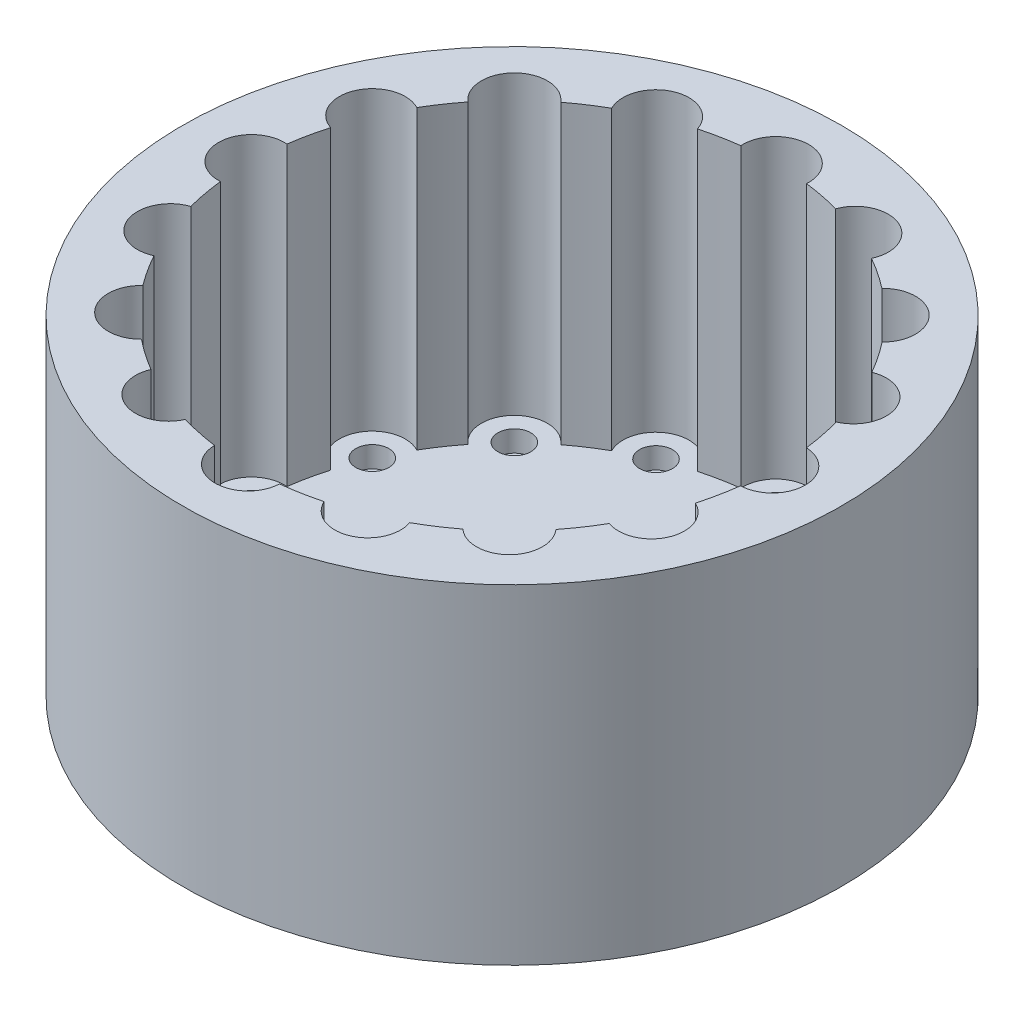
from build123d import *

# Parameters (mm, degrees)
SKETCH1_R           = 50
BOSS_EXTRUDE1_DEPTH = 45
BOSS_EXTRUDE2_START = 5
SKETCH2_R           = 50
BOSS_EXTRUDE2_DEPTH = 5
SKETCH4_R           = 17.5
CUT_EXTRUDE2_DEPTH  = 10
SKETCH5_R           = 2.5
CUT_EXTRUDE3_DEPTH  = 3.2


with BuildPart() as part:
    # Sketch1 → Boss-Extrude1 (new body)
    with BuildSketch(Plane(origin=(0, 0, 0), x_dir=(1, 0, 0), z_dir=(0, 1, 0))):
        Circle(SKETCH1_R)
        with BuildLine():
            ThreePointArc((-38.472091197, 10.949803601), (-39.142843019, 8.236373014), (-39.622464899, 5.482725176))
            ThreePointArc((-39.622464899, 5.482725176), (-45.027736203, 0.561560709), (-39.746875, -4.492875219))
            ThreePointArc((-39.746875, -4.492875219), (-39.333953887, -7.269117664), (-38.72736158, -10.009568673))
            ThreePointArc((-38.72736158, -10.009568673), (-41.748946282, -16.583911093), (-35.039748856, -19.292900251))
            ThreePointArc((-35.039748856, -19.292900251), (-33.590491244, -21.718169766), (-31.973653194, -24.035088963))
            ThreePointArc((-31.973653194, -24.035088963), (-32.157729031, -31.176050772), (-25.014492656, -31.213381059))
            ThreePointArc((-25.014492656, -31.213381059), (-22.728868069, -32.915020223), (-20.32789937, -34.449622744))
            ThreePointArc((-20.32789937, -34.449622744), (-17.707258167, -40.991172437), (-11.148020432, -38.415122549))
            ThreePointArc((-11.148020432, -38.415122549), (-8.358901204, -39.11686044), (-5.526568431, -39.6163734))
            ThreePointArc((-5.526568431, -39.6163734), (-0.59402965, -44.528471783), (4.46778962, -39.749702589))
            ThreePointArc((4.46778962, -39.749702589), (7.33562934, -39.321604013), (10.164921368, -38.686875986))
            ThreePointArc((10.164921368, -38.686875986), (16.574401115, -41.242300251), (19.433073291, -34.962203341))
            ThreePointArc((19.433073291, -34.962203341), (21.927230073, -33.454395546), (24.304976528, -31.768980405))
            ThreePointArc((24.304976528, -31.768980405), (31.177616874, -31.629495833), (31.415975195, -24.759573957))
            ThreePointArc((31.415975195, -24.759573957), (33.136656406, -22.404508524), (34.681152562, -19.930320042))
            ThreePointArc((34.681152562, -19.930320042), (40.985236081, -17.155873875), (38.537324177, -10.717959006))
            ThreePointArc((38.537324177, -10.717959006), (39.213686022, -7.892200491), (39.683137427, -5.024798895))
            ThreePointArc((39.683137427, -5.024798895), (44.500790375, -0.031685054), (39.690252613, 4.968284165))
            ThreePointArc((39.690252613, 4.968284165), (39.229069194, 7.815377799), (38.563928149, 10.62183815))
            ThreePointArc((38.563928149, 10.62183815), (41.191547229, 17.128956276), (34.724740733, 19.854278657))
            ThreePointArc((34.724740733, 19.854278657), (33.21843503, 22.283078202), (31.542548716, 24.598122296))
            ThreePointArc((31.542548716, 24.598122296), (31.568070741, 31.71029047), (24.456089141, 31.652799306))
            ThreePointArc((24.456089141, 31.652799306), (22.154728904, 33.304173721), (19.742272443, 34.788542349))
            ThreePointArc((19.742272443, 34.788542349), (17.102427339, 41.494962196), (10.503764758, 38.596255335))
            ThreePointArc((10.503764758, 38.596255335), (7.766185163, 39.238837496), (4.99022482, 39.6875))
            ThreePointArc((4.99022482, 39.6875), (0, 45), (-4.99022482, 39.6875))
            ThreePointArc((-4.99022482, 39.6875), (-7.752560801, 39.241531584), (-10.476960655, 38.603539934))
            ThreePointArc((-10.476960655, 38.603539934), (-17.137978748, 41.698652845), (-19.697351689, 34.813996272))
            ThreePointArc((-19.697351689, 34.813996272), (-22.077028029, 33.355731643), (-24.349225183, 31.735078903))
            ThreePointArc((-24.349225183, 31.735078903), (-31.708929174, 32.096652706), (-31.436823309, 24.733098071))
            ThreePointArc((-31.436823309, 24.733098071), (-33.084428294, 22.481561432), (-34.571077134, 20.120651724))
            ThreePointArc((-34.571077134, 20.120651724), (-41.501374638, 17.653486782), (-38.472091197, 10.949803601))
        make_face(mode=Mode.SUBTRACT)
    extrude(amount=BOSS_EXTRUDE1_DEPTH)

    # Sketch2 → Boss-Extrude2 (add)
    with BuildSketch(Plane.XZ.offset(BOSS_EXTRUDE2_START)):
        Circle(SKETCH2_R)
    extrude(amount=-BOSS_EXTRUDE2_DEPTH)

    # Sketch4 → Cut-Extrude2 (cut)
    with BuildSketch(Plane(origin=(0, 0, 0), x_dir=(1, 0, 0), z_dir=(0, 1, 0))):
        Circle(SKETCH4_R)
    extrude(amount=-CUT_EXTRUDE2_DEPTH, mode=Mode.SUBTRACT)

    # Sketch5 → Cut-Extrude3 (cut)
    with BuildSketch(Plane(origin=(0, 0, 0), x_dir=(1, 0, 0), z_dir=(0, 1, 0))):
        with Locations((-28.194944311, 28.539700305)):
            Circle(SKETCH5_R)
        with Locations((-15.237269827, 37.074011713)):
            Circle(SKETCH5_R)
        with Locations((0, 40)):
            Circle(SKETCH5_R)
        with Locations((15.197128966, 36.872209973)):
            Circle(SKETCH5_R)
        with Locations((-36.900334973, 15.696337323)):
            Circle(SKETCH5_R)
        with Locations((-40.028125, 0.499208358)):
            Circle(SKETCH5_R)
        with Locations((-37.102136713, -14.73806147)):
            Circle(SKETCH5_R)
        with Locations((-28.567825305, -27.695735954)):
            Circle(SKETCH5_R)
        with Locations((-15.724462323, -36.401126616)):
            Circle(SKETCH5_R)
        with Locations((-0.527333358, -39.528916642)):
            Circle(SKETCH5_R)
        with Locations((14.70993647, -36.602928355)):
            Circle(SKETCH5_R)
        with Locations((27.667610954, -28.068616947)):
            Circle(SKETCH5_R)
        with Locations((36.373001616, -15.225253966)):
            Circle(SKETCH5_R)
        with Locations((39.500791642, -0.028125)):
            Circle(SKETCH5_R)
        with Locations((36.574803355, 15.209144827)):
            Circle(SKETCH5_R)
        with Locations((28.040491947, 28.166819311)):
            Circle(SKETCH5_R)
    extrude(amount=-CUT_EXTRUDE3_DEPTH, mode=Mode.SUBTRACT)


solid = part.part
